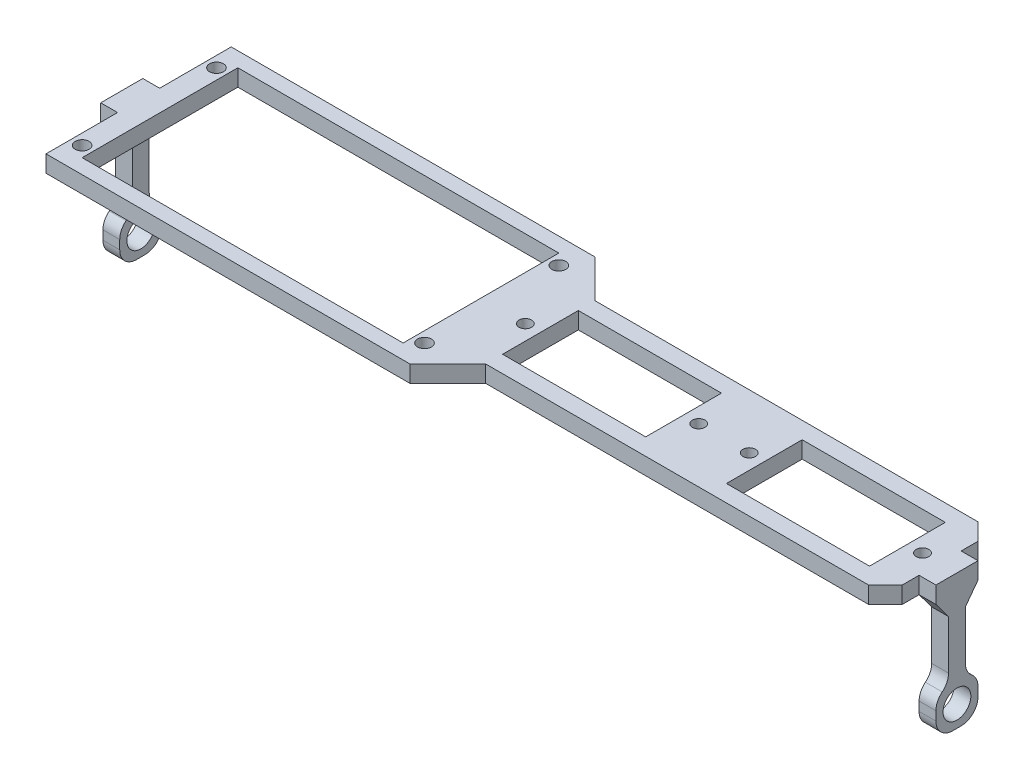
from build123d import *

# Parameters (mm, degrees)
ESQUISSE1_R        = 0.825
ESQUISSE1_R_2      = 0.75
ESQUISSE1_W        = 38.13
ESQUISSE1_H        = 18.5
ESQUISSE1_W_2      = 17
ESQUISSE1_H_2      = 9
ESQUISSE1_W_3      = 2
ESQUISSE1_H_3      = 5
BOSS_EXTRU_1_DEPTH = 2
CHANFREIN1_SIZE    = 2
ESQUISSE2_R        = 1.65
BOSS_EXTRU_2_DEPTH = 2
CONG_1_R           = 2
CONG_4_R           = 2


with BuildPart() as part:
    # Esquisse1 → Boss.-Extru.1 (new body)
    # profile 1 of 3: a face of its own
    with BuildSketch(Plane(origin=(0, 0, 0), x_dir=(1, 0, 0), z_dir=(0, 1, 0))):
        Polygon((-11.996169772, 14.323981369), (31.213830228, 14.323981369), (35.738830228, 9.823981369), (83.213830228, 9.823981369), (83.213830228, -3.176018631), (35.738830228, -3.176018631), (31.213830228, -7.676018631), (-11.996169772, -7.676018631), align=None)
        with Locations(Location((-10.726169772, 11.303981369, 0), (0, 0, 270))):
            Circle(ESQUISSE1_R, mode=Mode.SUBTRACT)
        with Locations(Location((29.943830228, 11.303981369, 0), (0, 0, 270))):
            Circle(ESQUISSE1_R, mode=Mode.SUBTRACT)
        with Locations(Location((29.943830228, -4.656018631, 0), (0, 0, 270))):
            Circle(ESQUISSE1_R, mode=Mode.SUBTRACT)
        with Locations(Location((-10.726169772, -4.656018631, 0), (0, 0, 270))):
            Circle(ESQUISSE1_R, mode=Mode.SUBTRACT)
        with Locations(Location((33.943830228, 3.323981369, 0), (0, 0, 270))):
            Circle(ESQUISSE1_R_2, mode=Mode.SUBTRACT)
        with Locations(Location((54.533830228, 3.323981369, 0), (0, 0, 270))):
            Circle(ESQUISSE1_R_2, mode=Mode.SUBTRACT)
        with Locations(Location((60.533830228, 3.323981369, 0), (0, 0, 270))):
            Circle(ESQUISSE1_R_2, mode=Mode.SUBTRACT)
        with Locations(Location((81.123830228, 3.323981369, 0), (0, 0, 270))):
            Circle(ESQUISSE1_R_2, mode=Mode.SUBTRACT)
        with Locations((9.608830228, 3.323981369)):
            Rectangle(ESQUISSE1_W, ESQUISSE1_H, mode=Mode.SUBTRACT)
        with Locations((44.238830228, 3.323981369)):
            Rectangle(ESQUISSE1_W_2, ESQUISSE1_H_2, mode=Mode.SUBTRACT)
        with Locations((70.828830228, 3.323981369)):
            Rectangle(ESQUISSE1_W_2, ESQUISSE1_H_2, mode=Mode.SUBTRACT)
    # profile 2 of 3: a face of its own
    with BuildSketch(Plane(origin=(0, 0, 0), x_dir=(1, 0, 0), z_dir=(0, 1, 0))):
        with Locations((-12.996169772, 3.323981369)):
            Rectangle(ESQUISSE1_W_3, ESQUISSE1_H_3)
    # profile 3 of 3: a face of its own
    with BuildSketch(Plane(origin=(0, 0, 0), x_dir=(1, 0, 0), z_dir=(0, 1, 0))):
        with Locations((84.213830228, 3.323981369)):
            Rectangle(ESQUISSE1_W_3, ESQUISSE1_H_3)
    extrude(amount=BOSS_EXTRU_1_DEPTH)

    # Chanfrein1
    chanfrein1_edges = [part.edges().sort_by_distance(p)[0] for p in [
        (83.213830228, 1, -9.823981369),
        (83.213830228, 1, 3.176018631),
    ]]
    chamfer(chanfrein1_edges, length=CHANFREIN1_SIZE)

    # Esquisse2 → Boss.-Extru.2 (add)
    with BuildSketch(Plane(origin=(85.213830228, 0, 0), x_dir=(0, 0, -1), z_dir=(1, 0, 0))):
        Polygon((5.823981369, 0), (0.823981369, 0), (2.323981369, -2), (2.323981369, -9), (0.823981369, -9), (0.823981369, -14), (5.823981369, -14), (5.823981369, -9), (4.323981369, -9), (4.323981369, -2), align=None)
        with Locations((3.323981369, -11.5)):
            Circle(ESQUISSE2_R, mode=Mode.SUBTRACT)
    boss_extru_2 = extrude(amount=-BOSS_EXTRU_2_DEPTH)

    # Symétrie1: Boss.-Extru.2 across plane
    add(boss_extru_2.mirror(Plane(origin=(35.738830228, 2, 0), x_dir=(0, 0, 1), z_dir=(-1, 0, 0))))

    # Congé1
    # the kernel refuses this fillet: 2 mm, written as the material it takes off along each edge
    with BuildSketch(Plane(origin=(90.213830228, -14, -5.823981369), x_dir=(0, 0, 1), z_dir=(-1, 0, 0)), Plane(origin=(90.213830228, -14, -0.823981369), x_dir=(0, 1, 0), z_dir=(-1, 0, 0))) as cong_1_piece_1:
        with BuildLine():
            CenterArc((CONG_1_R, CONG_1_R), CONG_1_R, 180, 90)
            Line((0, CONG_1_R), (-CONG_1_R * 0.02, CONG_1_R))
            Line((-CONG_1_R * 0.02, CONG_1_R), (-CONG_1_R * 0.02, -CONG_1_R * 0.02))
            Line((-CONG_1_R * 0.02, -CONG_1_R * 0.02), (CONG_1_R, -CONG_1_R * 0.02))
            Line((CONG_1_R, -CONG_1_R * 0.02), (CONG_1_R, 0))
        make_face()
    extrude(amount=12, mode=Mode.SUBTRACT)
    with BuildSketch(Plane(origin=(90.055059411, -9, -5.823981369), x_dir=(0, -1, 0), z_dir=(-1, 0, 0)), Plane(origin=(-18.577398955, -9, -0.823981369), x_dir=(0, -1, 0), z_dir=(1, 0, 0))) as cong_1_piece_2:
        with BuildLine():
            CenterArc((1.936491673, 2), CONG_1_R, 194.477512186, 75.522487814)
            Line((0, 1.5), (-0.038729833, 1.49))
            ThreePointArc((-0.038729833, 1.49), (-0.04, 0.75), (-0.04, 0))
            Line((-0.04, 0), (0, -0.04))
            Line((0, -0.04), (1.936491673, -0.04))
            Line((1.936491673, -0.04), (1.936491673, 0))
        make_face()
    extrude(amount=11.682458366, mode=Mode.SUBTRACT)
    with BuildSketch(Plane(origin=(90.055059411, -9, -0.823981369), x_dir=(0, -1, 0), z_dir=(-1, 0, 0)), Plane(origin=(-18.577398955, -9, -5.823981369), x_dir=(0, -1, 0), z_dir=(1, 0, 0))) as cong_1_piece_3:
        with BuildLine():
            CenterArc((1.936491673, -2), CONG_1_R, 90, 75.522487814)
            Line((0, -1.5), (-0.038729833, -1.49))
            ThreePointArc((-0.038729833, -1.49), (-0.04, -0.75), (-0.04, 0))
            Line((-0.04, 0), (0, 0.04))
            Line((0, 0.04), (1.936491673, 0.04))
            Line((1.936491673, 0.04), (1.936491673, 0))
        make_face()
    extrude(amount=11.682458366, mode=Mode.SUBTRACT)
    with BuildSketch(Plane(origin=(-18.736169772, -14, -5.823981369), x_dir=(0, 0, 1), z_dir=(1, 0, 0)), Plane(origin=(-18.736169772, -14, -0.823981369), x_dir=(0, 1, 0), z_dir=(1, 0, 0))) as cong_1_piece_4:
        with BuildLine():
            CenterArc((CONG_1_R, -CONG_1_R), CONG_1_R, 90, 90)
            Line((0, -CONG_1_R), (-CONG_1_R * 0.02, -CONG_1_R))
            Line((-CONG_1_R * 0.02, -CONG_1_R), (-CONG_1_R * 0.02, CONG_1_R * 0.02))
            Line((-CONG_1_R * 0.02, CONG_1_R * 0.02), (CONG_1_R, CONG_1_R * 0.02))
            Line((CONG_1_R, CONG_1_R * 0.02), (CONG_1_R, 0))
        make_face()
    extrude(amount=12, mode=Mode.SUBTRACT)

    # Congé4
    cong_4_edges = [part.edges().sort_by_distance(p)[0] for p in [
        (84.213830228, -9, -4.323981369),
        (84.213830228, -9, -2.323981369),
        (-12.736169772, -9, -4.323981369),
        (-12.736169772, -9, -2.323981369),
    ]]
    fillet(cong_4_edges, radius=CONG_4_R)


solid = part.part
